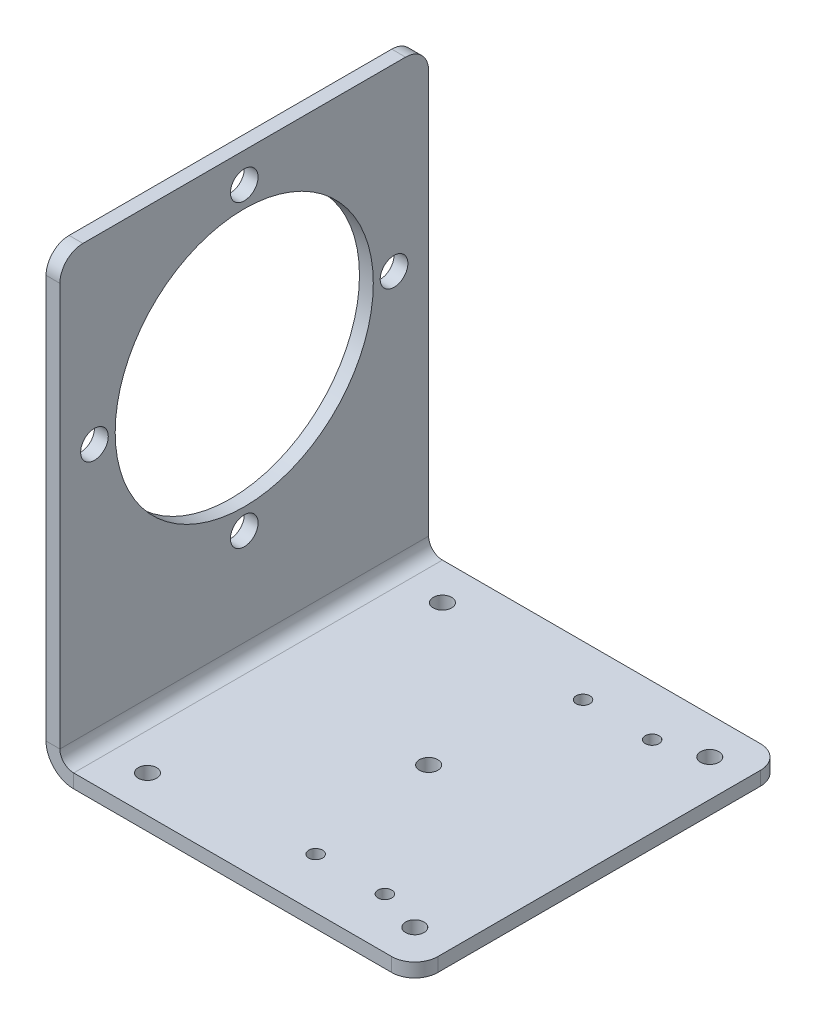
from build123d import *

# Parameters (mm, degrees)
SKETCH1_W                        = 80
SKETCH1_H                        = 98.5
SKETCH1_R                        = 28
BASE_FLANGE1_DEPTH               = 3
F_6_0_6_DIAMETER_HOLE1_D         = 6
CIRPATTERN1_COUNT                = 4
SM_EDGE_FLANGE_1_STRIP_W         = 18
SM_EDGE_FLANGE_1_STRIP_H         = 3
SM_EDGE_FLANGE_1_STRIP_CUT_DEPTH = 80
SM_EDGE_FLANGE_1_DEPTH           = 80
FILLET1_R                        = 5
F_4_0_4_DIAMETER_HOLE4_D         = 4
F_3_0_3_DIAMETER_HOLE2_D         = 3


# Sheet-metal steps are written as plain solids
with BuildPart() as part:
    # Sketch1 → Base-Flange1 (new body)
    with BuildSketch(Plane(origin=(0, 0, 0), x_dir=(0, 0, -1), z_dir=(1, 0, 0))):
        with Locations((40, 49.25)):
            Rectangle(SKETCH1_W, SKETCH1_H)
        with Locations((40, 59.5)):
            Circle(SKETCH1_R, mode=Mode.SUBTRACT)
    extrude(amount=-BASE_FLANGE1_DEPTH)

    # Ø6.0 (6) Diameter Hole1 (through all)
    with Locations(Plane(origin=(0, 0, 0), x_dir=(0, 0, -1), z_dir=(1, 0, 0))):
        with Locations((40, 92)):
            f_6_0_6_diameter_hole1 = Hole(F_6_0_6_DIAMETER_HOLE1_D / 2)

    # CirPattern1: Ø6.0 (6) Diameter Hole1 ×4 about axis
    cirpattern1_axis = Axis((0, 59.5, -40), (1, 0, 0))
    for i in range(1, CIRPATTERN1_COUNT):
        add(f_6_0_6_diameter_hole1.rotate(cirpattern1_axis, i * 360 / CIRPATTERN1_COUNT), mode=Mode.SUBTRACT)

    # 邊線-凸緣1 strip (across the edge) → 邊線-凸緣1 strip cut (cut)
    with BuildSketch(Plane.YX):
        with Locations((-3, -1.5)):
            Rectangle(SM_EDGE_FLANGE_1_STRIP_W, SM_EDGE_FLANGE_1_STRIP_H)
    extrude(amount=SM_EDGE_FLANGE_1_STRIP_CUT_DEPTH, mode=Mode.SUBTRACT)

    # 邊線-凸緣1 section (across the edge) → 邊線-凸緣1 (add)
    with BuildSketch(Plane.YX):
        with BuildLine():
            Line((0, 3), (0, 77))
            Line((0, 77), (3, 77))
            Line((3, 77), (3, 3))
            ThreePointArc((3, 3), (3.878679656, 0.878679656), (6, 0))
            Line((6, 0), (6, -3))
            ThreePointArc((6, -3), (1.757359313, -1.242640687), (0, 3))
        make_face()
    extrude(amount=SM_EDGE_FLANGE_1_DEPTH)

    # Fillet1
    fillet1_edges = [part.edges().sort_by_distance(p)[0] for p in [
        (77, 1.5, 0),
        (77, 1.5, -80),
        (-1.5, 98.5, 0),
        (-1.5, 98.5, -80),
    ]]
    fillet(fillet1_edges, radius=FILLET1_R)

    # Ø4.0 (4) Diameter Hole4 (through all)
    with Locations(Plane(origin=(0, 3, 0), x_dir=(1, 0, 0), z_dir=(0, 1, 0))):
        with Locations((11, 8), (11, 72), (69, 72), (69, 8), (40, 40)):
            Hole(F_4_0_4_DIAMETER_HOLE4_D / 2)

    # Ø3.0 (3) Diameter Hole2 (through all)
    with Locations(Plane(origin=(0, 3, 0), x_dir=(1, 0, 0), z_dir=(0, 1, 0))):
        with Locations((44.5, 11), (59.5, 11)):
            f_3_0_3_diameter_hole2 = Hole(F_3_0_3_DIAMETER_HOLE2_D / 2)

    # Mirror1: Ø3.0 (3) Diameter Hole2 across plane
    add(f_3_0_3_diameter_hole2.mirror(Plane.XY.offset(-40)), mode=Mode.SUBTRACT)


solid = part.part
